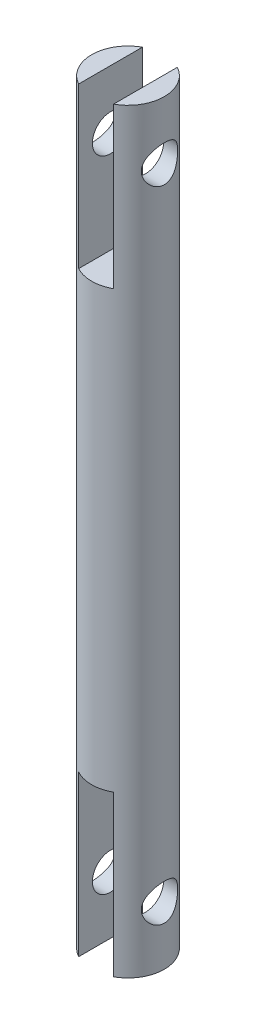
from build123d import *

# Parameters (mm, degrees)
SKETCH2_R               = 2.5
BOSS_EXTRUDE1_DEPTH     = 52
SKETCH3_W               = 2.4
SKETCH3_H               = 5
CUT_EXTRUDE1_DEPTH      = 11
CUT_EXTRUDE2_DEPTH      = 53.120053722
CUT_EXTRUDE2_DEPTH_BACK = 53.120053722
SKETCH4_R               = 1.25
SKETCH5_W               = 2.4
SKETCH5_H               = 5
CUT_EXTRUDE3_DEPTH      = 11


with BuildPart() as part:
    # Sketch2 → Boss-Extrude1 (new body)
    with BuildSketch(Plane(origin=(0, 0, 0), x_dir=(-1, 0, 0), z_dir=(0, 1, 0))):
        Circle(SKETCH2_R)
    extrude(amount=BOSS_EXTRUDE1_DEPTH)

    # Sketch3 → Cut-Extrude1 (cut)
    with BuildSketch(Plane.XZ):
        Rectangle(SKETCH3_W, SKETCH3_H)
    extrude(amount=-CUT_EXTRUDE1_DEPTH, mode=Mode.SUBTRACT)

    # Sketch4 → Cut-Extrude2 (cut, two sides: drawn at the far end of the back side and taken through both)
    with BuildSketch(Plane.YZ.offset(-CUT_EXTRUDE2_DEPTH_BACK)):
        with Locations((4, 0)):
            Circle(SKETCH4_R)
        with Locations((48, 0)):
            Circle(SKETCH4_R)
    extrude(amount=CUT_EXTRUDE2_DEPTH + CUT_EXTRUDE2_DEPTH_BACK, mode=Mode.SUBTRACT)

    # Sketch5 → Cut-Extrude3 (cut)
    with BuildSketch(Plane(origin=(0, 52, 0), x_dir=(-1, 0, 0), z_dir=(0, 1, 0))):
        Rectangle(SKETCH5_W, SKETCH5_H)
    extrude(amount=-CUT_EXTRUDE3_DEPTH, mode=Mode.SUBTRACT)


solid = part.part
